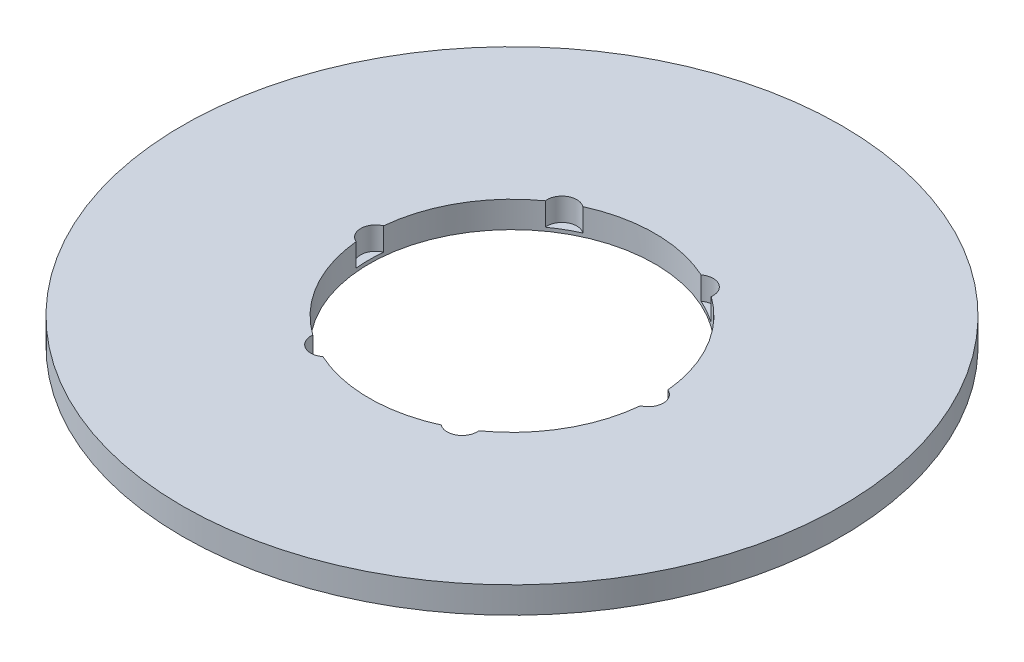
from build123d import *

# Parameters (mm, degrees)
SKETCH1_R           = 75
BOSS_EXTRUDE1_DEPTH = 6
SKETCH2_R           = 32.5
CUT_EXTRUDE1_DEPTH  = 107.235587258
SKETCH3_R           = 3.390748994
CUT_EXTRUDE2_DEPTH  = 5.20472754
CIRPATTERN1_COUNT   = 6


with BuildPart() as part:
    # Sketch1 → Boss-Extrude1 (new body)
    with BuildSketch(Plane(origin=(0, 0, 0), x_dir=(1, 0, 0), z_dir=(0, 1, 0))):
        Circle(SKETCH1_R)
    extrude(amount=BOSS_EXTRUDE1_DEPTH)

    # Sketch2 → Cut-Extrude1 (cut, through all)
    with BuildSketch(Plane(origin=(0, 0, 0), x_dir=(1, 0, 0), z_dir=(0, 1, 0))):
        Circle(SKETCH2_R)
    extrude(amount=CUT_EXTRUDE1_DEPTH, mode=Mode.SUBTRACT)

    # Sketch3 → Cut-Extrude2 (cut)
    with BuildSketch(Plane(origin=(0, 6, 0), x_dir=(1, 0, 0), z_dir=(0, 1, 0))):
        with Locations((-31.034865261, 0)):
            Circle(SKETCH3_R)
    cut_extrude2 = extrude(amount=-CUT_EXTRUDE2_DEPTH, mode=Mode.SUBTRACT)

    # CirPattern1: Cut-Extrude2 ×6 about axis
    cirpattern1_axis = Axis((0, 0, 0), (0, 1, 0))
    for i in range(1, CIRPATTERN1_COUNT):
        add(cut_extrude2.rotate(cirpattern1_axis, i * 360 / CIRPATTERN1_COUNT), mode=Mode.SUBTRACT)


solid = part.part
